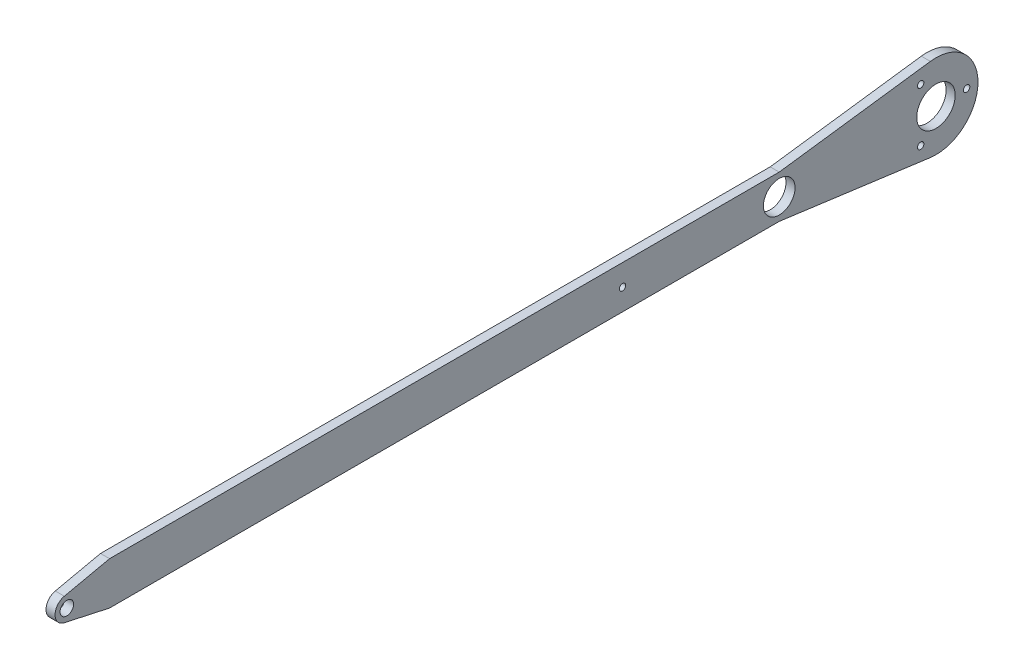
from build123d import *

# Parameters (mm, degrees)
SKETCH1_R            = 13.5
SKETCH1_R_2          = 11.1125
SKETCH1_R_3          = 4.7625
BOSS_EXTRUDE1_DEPTH  = 3.175
M4_CLEARANCE_HOLE1_D = 4.5


with BuildPart() as part:
    # Sketch1 → Boss-Extrude1 (new, symmetric)
    with BuildSketch(Plane(origin=(0, 0, 0), x_dir=(0, 0, -1), z_dir=(1, 0, 0))):
        with BuildLine():
            Line((-470, 15), (-501.760727799, 8.072716015))
            ThreePointArc((-501.760727799, 8.072716015), (-508.2625, 0), (-501.760727799, -8.072716015))
            Line((-501.760727799, -8.072716015), (-470, -15))
            Line((-470, -15), (0, -15))
            Line((0, -15), (106.075609583, -29.237803609))
            ThreePointArc((106.075609583, -29.237803609), (139.5, 0), (106.075609583, 29.237803609))
            Line((106.075609583, 29.237803609), (0, 15))
            Line((0, 15), (-470, 15))
        make_face()
        with Locations((110, 0)):
            Circle(SKETCH1_R, mode=Mode.SUBTRACT)
        Circle(SKETCH1_R_2, mode=Mode.SUBTRACT)
        with Locations((-500, 0)):
            Circle(SKETCH1_R_3, mode=Mode.SUBTRACT)
    extrude(amount=BOSS_EXTRUDE1_DEPTH, both=True)

    # M4 Clearance Hole1 (through all)
    with Locations(Plane(origin=(3.175, 0, 0), x_dir=(0, 0, -1), z_dir=(1, 0, 0))):
        with Locations((-110, 0), (131.5, 0), (99.25, -18.619546181), (99.25, 18.619546181)):
            Hole(M4_CLEARANCE_HOLE1_D / 2)


solid = part.part
